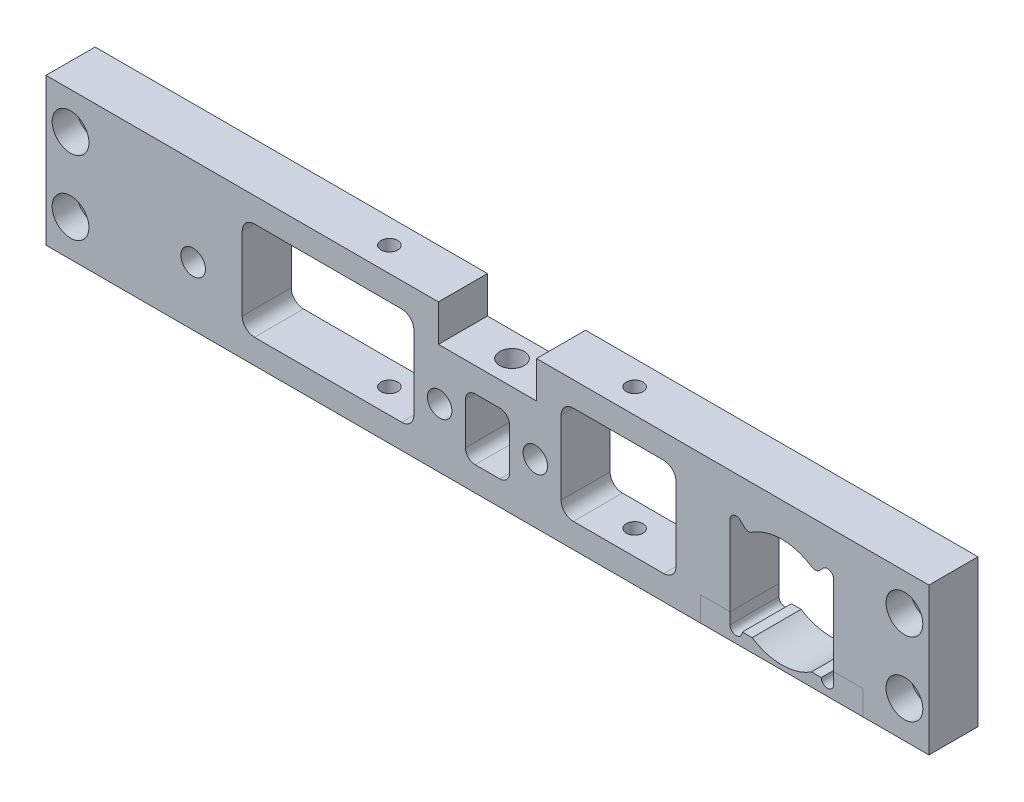
from build123d import *

# Parameters (mm, degrees)
SKETCH1_W                = 228.6
SKETCH1_H                = 38.1
BOSS_EXTRUDE1_DEPTH      = 12.7
CUT_EXTRUDE4_DEPTH       = 192.870900608
FILLET1_R                = 1.5875
SKETCH6_W                = 25.4
SKETCH6_H                = 9.525
CUT_EXTRUDE5_DEPTH       = 192.870900608
SKETCH7_W                = 11.43
SKETCH7_H                = 15.875
CUT_EXTRUDE6_DEPTH       = 192.870900608
SKETCH8_R                = 3.175
CUT_EXTRUDE7_DEPTH       = 6.35
SKETCH9_R                = 3.175
CUT_EXTRUDE8_DEPTH       = 192.870900608
SKETCH10_R               = 4.7625
CUT_EXTRUDE9_DEPTH       = 6.35
FILLET2_R                = 2.54
SURFACE_EXTRUDE1_1_BACK  = 12.7
SURFACE_EXTRUDE1_1_DEPTH = 12.7
SURFACE_EXTRUDE1_2_BACK  = 12.7
SURFACE_EXTRUDE1_2_DEPTH = 12.7
SKETCH12_R               = 1.4224
CUT_EXTRUDE10_DEPTH      = 15.24
CHAMFER1_SIZE            = 2.1082
CHAMFER1_SIZE2           = 1.832630301
CHAMFER2_SIZE            = 2.1082
CHAMFER2_SIZE2           = 1.832630301
SKETCH13_W               = 29.761064524
SKETCH13_H               = 25.4
SKETCH13_W_2             = 44.45
CUT_EXTRUDE11_DEPTH      = 192.870900608
FILLET3_R                = 3.175
SKETCH14_R               = 3.175
CUT_EXTRUDE12_DEPTH      = 192.870900608
SKETCH15_W               = 13.412933216
SKETCH15_H               = 11.176
CUT_EXTRUDE13_DEPTH      = 4
FILLET4_R                = 3.175
SKETCH16_R               = 3.175
CUT_EXTRUDE14_DEPTH      = 192.870900608
SKETCH17_R               = 2.159
CUT_EXTRUDE15_DEPTH      = 195.687313403


with BuildPart() as part:
    # Sketch1 → Boss-Extrude1 (new body)
    with BuildSketch(Plane.XY):
        with Locations((-76.2, 0)):
            Rectangle(SKETCH1_W, SKETCH1_H)
    extrude(amount=BOSS_EXTRUDE1_DEPTH)

    # Sketch5 → Cut-Extrude4 (cut, through all)
    with BuildSketch(Plane.XY.offset(12.7)):
        with BuildLine():
            Line((-8.772142836, 7.225167378), (-10.687223205, 9.140247747))
            ThreePointArc((-10.687223205, 9.140247747), (-12.431105504, 9.487127504), (-13.418935476, 8.008735476))
            Line((-13.418935476, 8.008735476), (-13.418935476, -15.628735476))
            ThreePointArc((-13.418935476, -15.628735476), (-11.818735476, -17.228935476), (-10.218535476, -15.628735476))
            Line((-10.218535476, -15.628735476), (-7.683937842, -15.628735476))
            ThreePointArc((-7.683937842, -15.628735476), (0, -17.907), (7.683937842, -15.628735476))
            Line((7.683937842, -15.628735476), (10.218535476, -15.628735476))
            ThreePointArc((10.218535476, -15.628735476), (11.818735476, -17.228935476), (13.418935476, -15.628735476))
            Line((13.418935476, -15.628735476), (13.418935476, 8.008735476))
            ThreePointArc((13.418935476, 8.008735476), (12.571582801, 9.420776887), (10.926920796, 9.337383893))
            Line((10.926920796, 9.337383893), (8.795831767, 7.206294864))
            ThreePointArc((8.795831767, 7.206294864), (0.015143788, 10.286991866), (-8.772142836, 7.225167378))
        make_face()
    extrude(amount=-CUT_EXTRUDE4_DEPTH, mode=Mode.SUBTRACT)

    # Fillet1
    fillet1_edges = [part.edges().sort_by_distance(p)[0] for p in [
        (-8.772142836, 7.225167378, 6.35),
        (8.795831767, 7.206294864, 6.35),
    ]]
    fillet(fillet1_edges, radius=FILLET1_R)

    # Sketch6 → Cut-Extrude5 (cut, through all)
    with BuildSketch(Plane.XY.offset(12.7)):
        with Locations((-76.2, 14.2875)):
            Rectangle(SKETCH6_W, SKETCH6_H)
    extrude(amount=-CUT_EXTRUDE5_DEPTH, mode=Mode.SUBTRACT)

    # Sketch7 → Cut-Extrude6 (cut, through all)
    with BuildSketch(Plane.XY.offset(12.7)):
        with Locations((-76.2, -4.7625)):
            Rectangle(SKETCH7_W, SKETCH7_H)
    extrude(amount=-CUT_EXTRUDE6_DEPTH, mode=Mode.SUBTRACT)

    # Sketch8 → Cut-Extrude7 (cut)
    with BuildSketch(Plane(origin=(0, 9.525, 0), x_dir=(1, 0, 0), z_dir=(0, 1, 0))):
        with Locations(Location((-76.2, -6.35, 0), (0, 0, 180))):
            Circle(SKETCH8_R)
    extrude(amount=-CUT_EXTRUDE7_DEPTH, mode=Mode.SUBTRACT)

    # Sketch9 → Cut-Extrude8 (cut, through all)
    with BuildSketch(Plane(origin=(0, 0, 0), x_dir=(-1, 0, 0), z_dir=(0, 0, -1))):
        with Locations((-31.75, 9.525)):
            Circle(SKETCH9_R)
        with Locations((-31.75, -9.525)):
            Circle(SKETCH9_R)
        with Locations((184.15, 9.525)):
            Circle(SKETCH9_R)
        with Locations((184.15, -9.525)):
            Circle(SKETCH9_R)
    extrude(amount=-CUT_EXTRUDE8_DEPTH, mode=Mode.SUBTRACT)

    # Sketch10 → Cut-Extrude9 (cut)
    with BuildSketch(Plane.XY.offset(12.7)):
        with Locations((-184.15, 9.525)):
            Circle(SKETCH10_R)
        with Locations((-184.15, -9.525)):
            Circle(SKETCH10_R)
        with Locations((31.75, 9.525)):
            Circle(SKETCH10_R)
        with Locations((31.75, -9.525)):
            Circle(SKETCH10_R)
    extrude(amount=-CUT_EXTRUDE9_DEPTH, mode=Mode.SUBTRACT)

    # Fillet2
    fillet2_edges = [part.edges().sort_by_distance(p)[0] for p in [
        (-70.485, -12.7, 6.35),
        (-81.915, -12.7, 6.35),
        (-81.915, 3.175, 6.35),
        (-70.485, 3.175, 6.35),
    ]]
    fillet(fillet2_edges, radius=FILLET2_R - 0.0001)  # a hair under: the kernel refuses the full size


with BuildPart() as body_2:
    # Split1: the piece behind the surface
    add(part.part)
    # Surface-Extrude1: a surface, the sketch's curves swept straight by 12.7 mm
    with BuildLine(Plane.XY.offset(12.7).offset(-SURFACE_EXTRUDE1_1_BACK), mode=Mode.PRIVATE) as surface_extrude1_1_path:
        Line((-21.038935476, -19.05), (-21.038935476, -12.7))
        Line((-21.038935476, -12.7), (21.038935476, -12.7))
        Line((21.038935476, -12.7), (21.038935476, -19.05))
    surface_extrude1_1 = Shell.extrude(surface_extrude1_1_path.wire(), (0 * SURFACE_EXTRUDE1_1_DEPTH, 0 * SURFACE_EXTRUDE1_1_DEPTH, 1 * SURFACE_EXTRUDE1_1_DEPTH))
    split(bisect_by=surface_extrude1_1, keep=Keep.BOTTOM)


with BuildPart() as part_1:
    add(part.part)

    # Split1: split by a surface, the side it looks to stays
    # Surface-Extrude1: a surface, the sketch's curves swept straight by 12.7 mm
    with BuildLine(Plane.XY.offset(12.7).offset(-SURFACE_EXTRUDE1_2_BACK), mode=Mode.PRIVATE) as surface_extrude1_2_path:
        Line((-21.038935476, -19.05), (-21.038935476, -12.7))
        Line((-21.038935476, -12.7), (21.038935476, -12.7))
        Line((21.038935476, -12.7), (21.038935476, -19.05))
    surface_extrude1_2 = Shell.extrude(surface_extrude1_2_path.wire(), (0 * SURFACE_EXTRUDE1_2_DEPTH, 0 * SURFACE_EXTRUDE1_2_DEPTH, 1 * SURFACE_EXTRUDE1_2_DEPTH))
    split(bisect_by=surface_extrude1_2, keep=Keep.TOP)


with BuildPart() as cut_extrude10_tool:
    # Sketch12 → Cut-Extrude10 (new body)
    with BuildSketch(Plane.XZ.offset(19.05)):
        with Locations((-17.228935476, 6.35)):
            Circle(SKETCH12_R)
        with Locations((17.228935476, 6.35)):
            Circle(SKETCH12_R)
    extrude(amount=-CUT_EXTRUDE10_DEPTH)


with BuildPart() as part_2:
    add(part_1.part)

    # Cut-Extrude10: cut by cut_extrude10_tool
    add(cut_extrude10_tool.part, mode=Mode.SUBTRACT)

    # Sketch13 → Cut-Extrude11 (cut, through all)
    with BuildSketch(Plane.XY.offset(12.7)):
        with Locations((-42.269467738, 0)):
            Rectangle(SKETCH13_W, SKETCH13_H)
        with Locations((-117.475, 0)):
            Rectangle(SKETCH13_W_2, SKETCH13_H)
    extrude(amount=-CUT_EXTRUDE11_DEPTH, mode=Mode.SUBTRACT)

    # Fillet3
    fillet3_edges = [part_2.edges().sort_by_distance(p)[0] for p in [
        (-57.15, -12.7, 6.35),
        (-57.15, 12.7, 6.35),
        (-27.388935476, 12.7, 6.35),
        (-27.388935476, -12.7, 6.35),
        (-95.25, 12.7, 6.35),
        (-95.25, -12.7, 6.35),
        (-139.7, -12.7, 6.35),
        (-139.7, 12.7, 6.35),
    ]]
    fillet(fillet3_edges, radius=FILLET3_R)

    # Sketch14 → Cut-Extrude12 (cut, through all)
    with BuildSketch(Plane.XY.offset(12.7)):
        with Locations((-152.4, -3.81)):
            Circle(SKETCH14_R)
    extrude(amount=-CUT_EXTRUDE12_DEPTH, mode=Mode.SUBTRACT)

    # Sketch15 → Cut-Extrude13 (cut)
    with BuildSketch(Plane(origin=(0, 0, 0), x_dir=(-1, 0, 0), z_dir=(0, 0, -1))):
        with Locations((152.4, -3.81)):
            Rectangle(SKETCH15_W, SKETCH15_H)
    extrude(amount=-CUT_EXTRUDE13_DEPTH, mode=Mode.SUBTRACT)

    # Fillet4
    fillet4_edges = [part_2.edges().sort_by_distance(p)[0] for p in [
        (-159.106466608, 1.778, 2),
        (-159.106466608, -9.398, 2),
        (-145.693533392, -9.398, 2),
        (-145.693533392, 1.778, 2),
    ]]
    fillet(fillet4_edges, radius=FILLET4_R)

    # Sketch16 → Cut-Extrude14 (cut, through all)
    with BuildSketch(Plane(origin=(0, 0, 0), x_dir=(-1, 0, 0), z_dir=(0, 0, -1))):
        with Locations((63.8175, -3.683)):
            Circle(SKETCH16_R)
        with Locations((88.5825, -3.683)):
            Circle(SKETCH16_R)
    extrude(amount=-CUT_EXTRUDE14_DEPTH, mode=Mode.SUBTRACT)

    # Sketch17 → Cut-Extrude15 (cut, through all)
    with BuildSketch(Plane(origin=(0, 19.05, 0), x_dir=(1, 0, 0), z_dir=(0, 1, 0))):
        with Locations(Location((-107.95, -6.35, 0), (0, 0, 270))):
            Circle(SKETCH17_R)
        with Locations(Location((-44.45, -6.35, 0), (0, 0, 270))):
            Circle(SKETCH17_R)
    extrude(amount=-CUT_EXTRUDE15_DEPTH, mode=Mode.SUBTRACT)


with BuildPart() as body_2_1:
    add(body_2.part)

    # Cut-Extrude10: cut by cut_extrude10_tool
    add(cut_extrude10_tool.part, mode=Mode.SUBTRACT)

    # Chamfer1
    chamfer1_edges = [body_2_1.edges().sort_by_distance(p)[0] for p in [
        (15.806535476, -19.05, 6.35),
    ]]
    chamfer1_side = [body_2_1.faces().sort_by_distance(p)[0] for p in [
        (15.806535476, -15.875, 6.35),
    ]]
    chamfer(chamfer1_edges, length=CHAMFER1_SIZE, length2=CHAMFER1_SIZE2, reference=chamfer1_side[0])

    # Chamfer2
    chamfer2_edges = [body_2_1.edges().sort_by_distance(p)[0] for p in [
        (-18.651335476, -19.05, 6.35),
    ]]
    chamfer2_side = [body_2_1.faces().sort_by_distance(p)[0] for p in [
        (-18.651335476, -15.875, 6.35),
    ]]
    chamfer(chamfer2_edges, length=CHAMFER2_SIZE, length2=CHAMFER2_SIZE2, reference=chamfer2_side[0])


solid = Compound([part_2.part, body_2_1.part])
